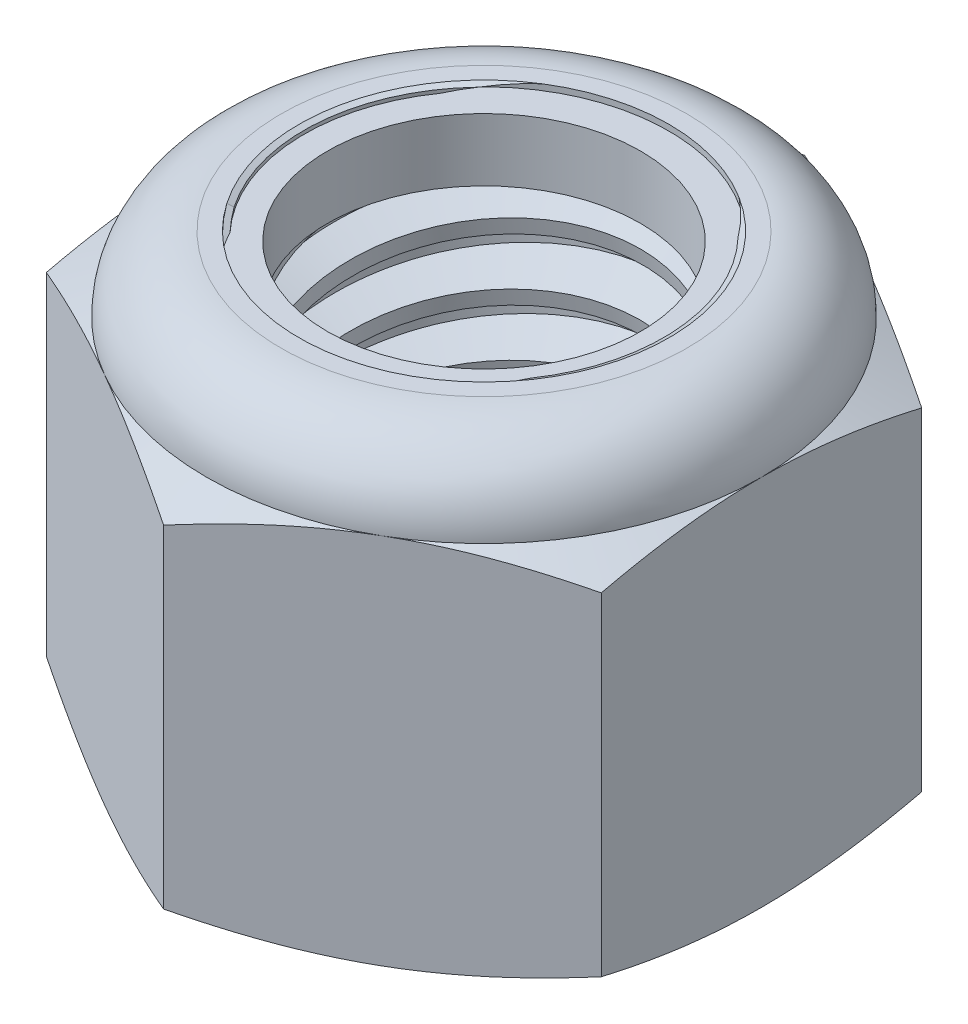
from build123d import *

# Parameters (mm, degrees)
EXTRUDE1_DEPTH       = 11.509375
SKETCH2_W            = 4.7625
SKETCH2_H            = 11.509375
LPATTERN1_COUNT      = 7
LPATTERN1_PITCH      = 1.5875
LPATTERN1_COUNT_DIR2 = 2
LPATTERN1_PITCH_DIR2 = 1.5875


with BuildPart() as part:
    # Sketch1 → Extrude1 (new body)
    with BuildSketch(Plane(origin=(0, 0, 0), x_dir=(1, 0, 0), z_dir=(0, 1, 0))):
        Polygon((0, 8.248891971), (-7.14375, 4.124445986), (-7.14375, -4.124445986), (0, -8.248891971), (7.14375, -4.124445986), (7.14375, 4.124445986), align=None)
    extrude(amount=EXTRUDE1_DEPTH)

    # Sketch4 → Cut-Revolve2 (revolve, cut)
    with BuildSketch(Plane(origin=(0, 0, 0), x_dir=(0, 0, -1), z_dir=(1, 0, 0))):
        Polygon((0, 11.509375), (4.7625, 11.509375), (4.029111805, 11.167390468), (4.029111805, 0.341984532), (4.7625, 0), (0, 0), align=None)
    revolve(axis=Axis((0, 11.509375, 0), (0, 1, 0)), mode=Mode.SUBTRACT)


with BuildPart() as body_2:
    # Sketch2 → Revolve1 (revolve)
    with BuildSketch(Plane(origin=(0, 0, 0), x_dir=(0, 0, -1), z_dir=(1, 0, 0))):
        with Locations((2.38125, 5.7546875)):
            Rectangle(SKETCH2_W, SKETCH2_H)
    revolve(axis=Axis((0, -4.7625, 0), (0, 1, 0)))

    # Sketch3 → Cut-Revolve1 (revolve, cut)
    with BuildSketch(Plane(origin=(0, 0, 0), x_dir=(0, 0, -1), z_dir=(1, 0, 0))):
        Polygon((4.795122924, 11.313637456), (5.023483392, 9.943474646), (4.094357653, 10.291557102), (4.029111805, 10.68303219), align=None)
    cut_revolve1 = revolve(axis=Axis((0, 11.509375, 0.28317269), (0, -0.9863939238321437, -0.1643989873053572)), mode=Mode.SUBTRACT)

    # LPattern1: Cut-Revolve1 7 × 2
    with Locations(*[Vector(0, -1, 0) * (i * LPATTERN1_PITCH) + Vector(0, 1, 0) * (j * LPATTERN1_PITCH_DIR2) for i in range(LPATTERN1_COUNT) for j in range(LPATTERN1_COUNT_DIR2) if (i, j) != (0, 0)]):
        add(cut_revolve1, mode=Mode.SUBTRACT)


with BuildPart() as part_1:
    add(part.part)

    # Combine1: cut body 2
    add(body_2.part, mode=Mode.SUBTRACT)

    # Sketch5 → Cut-Revolve3 (revolve, cut)
    with BuildSketch(Plane(origin=(0, 0, 0), x_dir=(0, 0, -1), z_dir=(1, 0, 0))):
        with BuildLine():
            Line((0, 0), (7.14375, 0))
            Line((7.14375, 0), (8.248891971, 0.515336164))
            Line((8.248891971, 0.515336164), (8.248891971, 9.075809669))
            Line((8.248891971, 9.075809669), (7.14375, 9.591145833))
            ThreePointArc((7.14375, 9.591145833), (6.581913685, 10.947538685), (5.225520833, 11.509375))
            Line((5.225520833, 11.509375), (5.225520833, 12.779375))
            Line((5.225520833, 12.779375), (9.518891971, 12.779375))
            Line((9.518891971, 12.779375), (9.518891971, -1.27))
            Line((9.518891971, -1.27), (0, -1.27))
            Line((0, -1.27), (0, 0))
        make_face()
    revolve(axis=Axis((0, 0, 0), (0, 1, 0)), mode=Mode.SUBTRACT)

    # Sketch6 → Cut-Revolve4 (revolve, cut)
    with BuildSketch(Plane(origin=(0, 0, 0), x_dir=(0, 0, -1), z_dir=(1, 0, 0))):
        with BuildLine():
            Line((0, 9.591145833), (6.99135, 9.591145833))
            ThreePointArc((6.99135, 9.591145833), (6.474150612, 10.839775612), (5.225520833, 11.356975))
            Line((5.225520833, 11.356975), (4.627316319, 11.356975))
            Line((4.627316319, 11.356975), (4.627316319, 12.779375))
            Line((4.627316319, 12.779375), (0, 12.779375))
            Line((0, 12.779375), (0, 9.591145833))
        make_face()
    revolve(axis=Axis((0, 12.779375, 0), (0, 1, 0)), mode=Mode.SUBTRACT)


with BuildPart() as body_2_2:
    # Sketch7 → Revolve2 (revolve)
    with BuildSketch(Plane(origin=(0, 0, 0), x_dir=(0, 0, -1), z_dir=(1, 0, 0))):
        with BuildLine():
            Line((4.029111805, 9.667345833), (6.913430867, 9.667345833))
            ThreePointArc((6.913430867, 9.667345833), (6.39301751, 10.812537757), (5.225520833, 11.280775))
            Line((5.225520833, 11.280775), (4.029111805, 11.280775))
            Line((4.029111805, 11.280775), (4.029111805, 9.667345833))
        make_face()
    revolve(axis=Axis((0, 9.667345833, 0), (0, 1, 0)))


solid = Compound([part_1.part, body_2_2.part])
